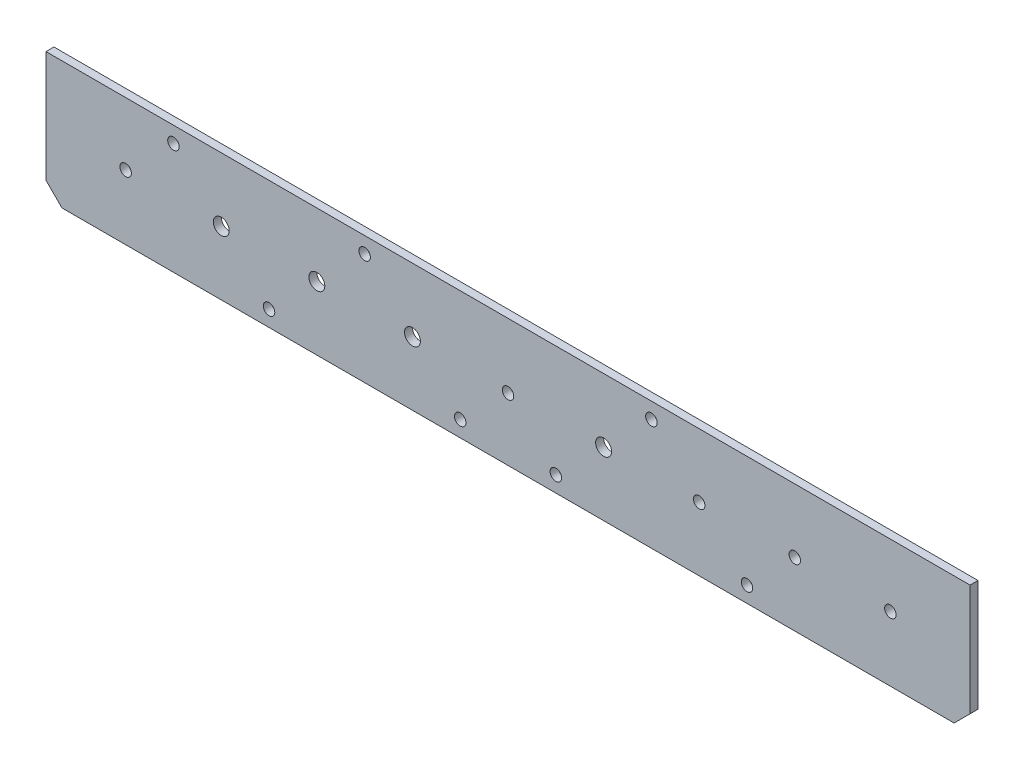
from build123d import *

# Parameters (mm, degrees)
SKETCH1_W           = 368.3
SKETCH1_H           = 50.8
BOSS_EXTRUDE1_DEPTH = 3.175
CUT_EXTRUDE1_REACH  = 373.8
SKETCH2_R           = 2.286
SKETCH2_R_2         = 3.175


with BuildPart() as part:
    # Sketch1 → Boss-Extrude1 (new body)
    with BuildSketch(Plane.XY):
        with Locations((184.15, 25.4)):
            Rectangle(SKETCH1_W, SKETCH1_H)
    extrude(amount=BOSS_EXTRUDE1_DEPTH)

    # Sketch2 → Cut-Extrude1 (cut, up to next)
    with BuildSketch(Plane.XY.offset(3.175), mode=Mode.PRIVATE) as cut_extrude1_sk1:
        with Locations((31.75, 25.796875)):
            Circle(SKETCH2_R)
    cut_extrude1_tool1 = extrude(cut_extrude1_sk1.sketch, amount=-CUT_EXTRUDE1_REACH, mode=Mode.PRIVATE) & part.part
    # Sketch2 → Cut-Extrude1 (cut, up to next)
    with BuildSketch(Plane.XY.offset(3.175), mode=Mode.PRIVATE) as cut_extrude1_sk2:
        with Locations((184.15, 25.003125)):
            Circle(SKETCH2_R)
    cut_extrude1_tool2 = extrude(cut_extrude1_sk2.sketch, amount=-CUT_EXTRUDE1_REACH, mode=Mode.PRIVATE) & part.part
    # Sketch2 → Cut-Extrude1 (cut, up to next)
    with BuildSketch(Plane.XY.offset(3.175), mode=Mode.PRIVATE) as cut_extrude1_sk3:
        with Locations((107.95, 25.4)):
            Circle(SKETCH2_R_2)
    cut_extrude1_tool3 = extrude(cut_extrude1_sk3.sketch, amount=-CUT_EXTRUDE1_REACH, mode=Mode.PRIVATE) & part.part
    # Sketch2 → Cut-Extrude1 (cut, up to next)
    with BuildSketch(Plane.XY.offset(3.175), mode=Mode.PRIVATE) as cut_extrude1_sk4:
        with Locations((69.85, 25.4)):
            Circle(SKETCH2_R_2)
    cut_extrude1_tool4 = extrude(cut_extrude1_sk4.sketch, amount=-CUT_EXTRUDE1_REACH, mode=Mode.PRIVATE) & part.part
    # Sketch2 → Cut-Extrude1 (cut, up to next)
    with BuildSketch(Plane.XY.offset(3.175), mode=Mode.PRIVATE) as cut_extrude1_sk5:
        with Locations((146.05, 25.4)):
            Circle(SKETCH2_R_2)
    cut_extrude1_tool5 = extrude(cut_extrude1_sk5.sketch, amount=-CUT_EXTRUDE1_REACH, mode=Mode.PRIVATE) & part.part
    # Sketch2 → Cut-Extrude1 (cut, up to next)
    with BuildSketch(Plane.XY.offset(3.175), mode=Mode.PRIVATE) as cut_extrude1_sk6:
        with Locations((222.25, 25.4)):
            Circle(SKETCH2_R_2)
    cut_extrude1_tool6 = extrude(cut_extrude1_sk6.sketch, amount=-CUT_EXTRUDE1_REACH, mode=Mode.PRIVATE) & part.part
    # Sketch2 → Cut-Extrude1 (cut, up to next)
    with BuildSketch(Plane.XY.offset(3.175), mode=Mode.PRIVATE) as cut_extrude1_sk7:
        with Locations((298.45, 25.4)):
            Circle(SKETCH2_R)
    cut_extrude1_tool7 = extrude(cut_extrude1_sk7.sketch, amount=-CUT_EXTRUDE1_REACH, mode=Mode.PRIVATE) & part.part
    # Sketch2 → Cut-Extrude1 (cut, up to next)
    with BuildSketch(Plane.XY.offset(3.175), mode=Mode.PRIVATE) as cut_extrude1_sk8:
        with Locations((260.35, 25.4)):
            Circle(SKETCH2_R)
    cut_extrude1_tool8 = extrude(cut_extrude1_sk8.sketch, amount=-CUT_EXTRUDE1_REACH, mode=Mode.PRIVATE) & part.part
    # Sketch2 → Cut-Extrude1 (cut, up to next)
    with BuildSketch(Plane.XY.offset(3.175), mode=Mode.PRIVATE) as cut_extrude1_sk9:
        with Locations((336.55, 25.796875)):
            Circle(SKETCH2_R)
    cut_extrude1_tool9 = extrude(cut_extrude1_sk9.sketch, amount=-CUT_EXTRUDE1_REACH, mode=Mode.PRIVATE) & part.part
    # Sketch2 → Cut-Extrude1 (cut, up to next)
    with BuildSketch(Plane.XY.offset(3.175), mode=Mode.PRIVATE) as cut_extrude1_sk10:
        with Locations((50.8, 44.45)):
            Circle(SKETCH2_R)
    cut_extrude1_tool10 = extrude(cut_extrude1_sk10.sketch, amount=-CUT_EXTRUDE1_REACH, mode=Mode.PRIVATE) & part.part
    # Sketch2 → Cut-Extrude1 (cut, up to next)
    with BuildSketch(Plane.XY.offset(3.175), mode=Mode.PRIVATE) as cut_extrude1_sk11:
        with Locations((165.1, 6.35)):
            Circle(SKETCH2_R)
    cut_extrude1_tool11 = extrude(cut_extrude1_sk11.sketch, amount=-CUT_EXTRUDE1_REACH, mode=Mode.PRIVATE) & part.part
    # Sketch2 → Cut-Extrude1 (cut, up to next)
    with BuildSketch(Plane.XY.offset(3.175), mode=Mode.PRIVATE) as cut_extrude1_sk12:
        with Locations((203.2, 6.35)):
            Circle(SKETCH2_R)
    cut_extrude1_tool12 = extrude(cut_extrude1_sk12.sketch, amount=-CUT_EXTRUDE1_REACH, mode=Mode.PRIVATE) & part.part
    # Sketch2 → Cut-Extrude1 (cut, up to next)
    with BuildSketch(Plane.XY.offset(3.175), mode=Mode.PRIVATE) as cut_extrude1_sk13:
        with Locations((127, 44.45)):
            Circle(SKETCH2_R)
    cut_extrude1_tool13 = extrude(cut_extrude1_sk13.sketch, amount=-CUT_EXTRUDE1_REACH, mode=Mode.PRIVATE) & part.part
    # Sketch2 → Cut-Extrude1 (cut, up to next)
    with BuildSketch(Plane.XY.offset(3.175), mode=Mode.PRIVATE) as cut_extrude1_sk14:
        with Locations((241.3, 44.45)):
            Circle(SKETCH2_R)
    cut_extrude1_tool14 = extrude(cut_extrude1_sk14.sketch, amount=-CUT_EXTRUDE1_REACH, mode=Mode.PRIVATE) & part.part
    # Sketch2 → Cut-Extrude1 (cut, up to next)
    with BuildSketch(Plane.XY.offset(3.175), mode=Mode.PRIVATE) as cut_extrude1_sk15:
        with Locations((88.9, 6.35)):
            Circle(SKETCH2_R)
    cut_extrude1_tool15 = extrude(cut_extrude1_sk15.sketch, amount=-CUT_EXTRUDE1_REACH, mode=Mode.PRIVATE) & part.part
    # Sketch2 → Cut-Extrude1 (cut, up to next)
    with BuildSketch(Plane.XY.offset(3.175), mode=Mode.PRIVATE) as cut_extrude1_sk16:
        with Locations((279.4, 6.35)):
            Circle(SKETCH2_R)
    cut_extrude1_tool16 = extrude(cut_extrude1_sk16.sketch, amount=-CUT_EXTRUDE1_REACH, mode=Mode.PRIVATE) & part.part
    # Sketch2 → Cut-Extrude1 (cut, up to next)
    with BuildSketch(Plane.XY.offset(3.175), mode=Mode.PRIVATE) as cut_extrude1_sk17:
        Polygon((0, 6.35), (0, 0), (6.35, 0), align=None)
    cut_extrude1_tool17 = extrude(cut_extrude1_sk17.sketch, amount=-CUT_EXTRUDE1_REACH, mode=Mode.PRIVATE) & part.part
    # Sketch2 → Cut-Extrude1 (cut, up to next)
    with BuildSketch(Plane.XY.offset(3.175), mode=Mode.PRIVATE) as cut_extrude1_sk18:
        Polygon((368.3, 0), (361.95, 0), (368.3, 6.35), align=None)
    cut_extrude1_tool18 = extrude(cut_extrude1_sk18.sketch, amount=-CUT_EXTRUDE1_REACH, mode=Mode.PRIVATE) & part.part
    add(cut_extrude1_tool1.solids().sort_by_distance((31.75, 25.796875, 3.175))[0], mode=Mode.SUBTRACT)
    add(cut_extrude1_tool2.solids().sort_by_distance((184.15, 25.003125, 3.175))[0], mode=Mode.SUBTRACT)
    add(cut_extrude1_tool3.solids().sort_by_distance((107.95, 25.4, 3.175))[0], mode=Mode.SUBTRACT)
    add(cut_extrude1_tool4.solids().sort_by_distance((69.85, 25.4, 3.175))[0], mode=Mode.SUBTRACT)
    add(cut_extrude1_tool5.solids().sort_by_distance((146.05, 25.4, 3.175))[0], mode=Mode.SUBTRACT)
    add(cut_extrude1_tool6.solids().sort_by_distance((222.25, 25.4, 3.175))[0], mode=Mode.SUBTRACT)
    add(cut_extrude1_tool7.solids().sort_by_distance((298.45, 25.4, 3.175))[0], mode=Mode.SUBTRACT)
    add(cut_extrude1_tool8.solids().sort_by_distance((260.35, 25.4, 3.175))[0], mode=Mode.SUBTRACT)
    add(cut_extrude1_tool9.solids().sort_by_distance((336.55, 25.796875, 3.175))[0], mode=Mode.SUBTRACT)
    add(cut_extrude1_tool10.solids().sort_by_distance((50.8, 44.45, 3.175))[0], mode=Mode.SUBTRACT)
    add(cut_extrude1_tool11.solids().sort_by_distance((165.1, 6.35, 3.175))[0], mode=Mode.SUBTRACT)
    add(cut_extrude1_tool12.solids().sort_by_distance((203.2, 6.35, 3.175))[0], mode=Mode.SUBTRACT)
    add(cut_extrude1_tool13.solids().sort_by_distance((127, 44.45, 3.175))[0], mode=Mode.SUBTRACT)
    add(cut_extrude1_tool14.solids().sort_by_distance((241.3, 44.45, 3.175))[0], mode=Mode.SUBTRACT)
    add(cut_extrude1_tool15.solids().sort_by_distance((88.9, 6.35, 3.175))[0], mode=Mode.SUBTRACT)
    add(cut_extrude1_tool16.solids().sort_by_distance((279.4, 6.35, 3.175))[0], mode=Mode.SUBTRACT)
    add(cut_extrude1_tool17.solids().sort_by_distance((2.116667, 2.116667, 3.175))[0], mode=Mode.SUBTRACT)
    add(cut_extrude1_tool18.solids().sort_by_distance((366.183333, 2.116667, 3.175))[0], mode=Mode.SUBTRACT)


solid = part.part
